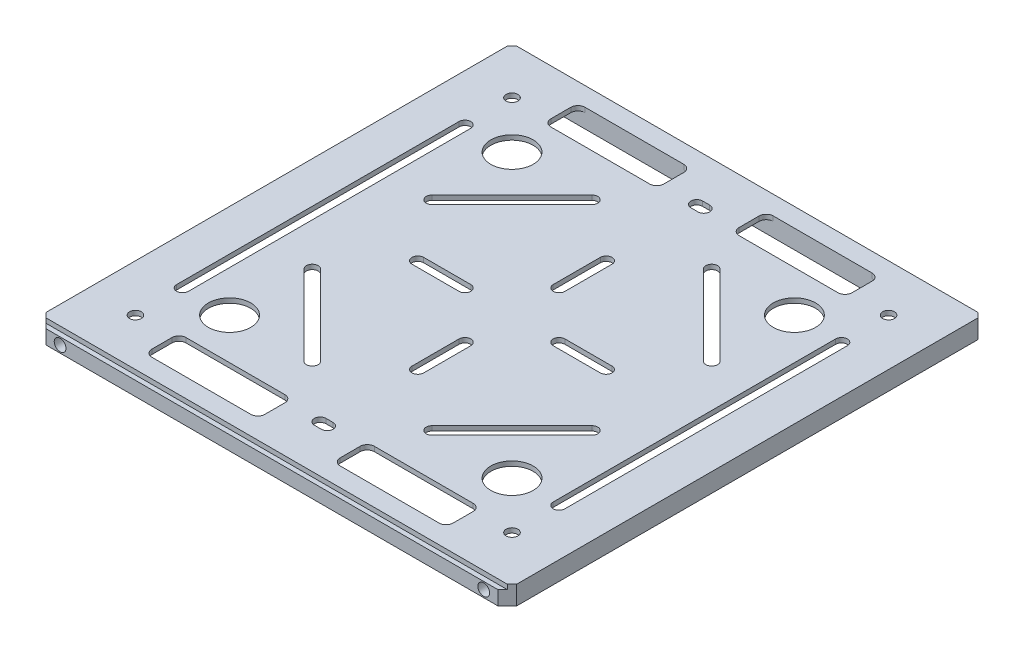
from build123d import *

# Parameters (mm, degrees)
SKETCH2_W                            = 100
SKETCH2_H                            = 100
BOSS_EXTRUDE1_DEPTH                  = 4
CUT_EXTRUDE1_DEPTH                   = 5
SKETCH4_R                            = 1.25
CUT_EXTRUDE2_DEPTH                   = 5
SKETCH5_W                            = 24
SKETCH5_H                            = 7.25
CUT_EXTRUDE3_DEPTH                   = 5
FILLET1_R                            = 1.5
CUT_EXTRUDE4_DEPTH                   = 5
CUT_EXTRUDE6_DEPTH                   = 5
FILLET1_OF_MIRROR1_R                 = 1.5
MIRROR2_DEPTH                        = 4
SKETCH9_W                            = 92
SKETCH9_H                            = 92
CUT_EXTRUDE7_DEPTH                   = 3
FILLET2_R                            = 1.5
CIRPATTERN1_COUNT                    = 4
CUT_EXTRUDE8_DEPTH                   = 10
CIRPATTERN2_COUNT                    = 4
SKETCH11_W                           = 100
SKETCH11_H                           = 3
BOSS_EXTRUDE2_DEPTH                  = 1
CHAMFER1_SIZE                        = 2
CHAMFER2_SIZE                        = 2
CHAMFER3_SIZE                        = 2
CHAMFER4_SIZE                        = 2
TAP_DRILL_FOR_M3X0_5_TAP1_AT_2_COUNT = 2
TAP_DRILL_FOR_M3X0_5_TAP1_AT_2_PITCH = 90
CIRPATTERN4_COUNT                    = 4
F_9_0_9_DIAMETER_HOLE1_D             = 9
CIRPATTERN5_COUNT                    = 4


# Read off the part's stored shape, not the designer's step: Mirror2
with BuildPart() as part:
    # Sketch2 → Boss-Extrude1 (new body)
    with BuildSketch(Plane(origin=(0, 0, 0), x_dir=(1, 0, 0), z_dir=(0, 1, 0))):
        with Locations((50, 50)):
            Rectangle(SKETCH2_W, SKETCH2_H)
    extrude(amount=BOSS_EXTRUDE1_DEPTH)

    # Sketch3 → Cut-Extrude1 (cut)
    with BuildSketch(Plane(origin=(0, 4, 0), x_dir=(1, 0, 0), z_dir=(0, 1, 0))):
        with BuildLine():
            Line((11.25, 80), (11.25, 20))
            ThreePointArc((11.25, 20), (10, 18.75), (8.75, 20))
            Line((8.75, 20), (8.75, 80))
            ThreePointArc((8.75, 80), (10, 81.25), (11.25, 80))
        make_face()
    cut_extrude1 = extrude(amount=-CUT_EXTRUDE1_DEPTH, mode=Mode.SUBTRACT)

    # Sketch4 → Cut-Extrude2 (cut)
    with BuildSketch(Plane(origin=(0, 4, 0), x_dir=(1, 0, 0), z_dir=(0, 1, 0))):
        with Locations(Location((10, 10, 0), (0, 0, 270))):
            Circle(SKETCH4_R)
    cut_extrude2 = extrude(amount=-CUT_EXTRUDE2_DEPTH, mode=Mode.SUBTRACT)

    # Sketch5 → Cut-Extrude3 (cut)
    with BuildSketch(Plane(origin=(0, 4, 0), x_dir=(1, 0, 0), z_dir=(0, 1, 0))):
        with Locations((30, 7.625)):
            Rectangle(SKETCH5_W, SKETCH5_H)
    cut_extrude3 = extrude(amount=-CUT_EXTRUDE3_DEPTH, mode=Mode.SUBTRACT)

    # Fillet1
    fillet1_edges = [part.edges().sort_by_distance(p)[0] for p in [
        (18, 2, -4),
        (18, 2, -11.25),
        (42, 2, -11.25),
        (42, 2, -4),
    ]]
    fillet(fillet1_edges, radius=FILLET1_R)

    # Sketch6 → Cut-Extrude4 (cut)
    with BuildSketch(Plane(origin=(0, 4, 0), x_dir=(1, 0, 0), z_dir=(0, 1, 0))):
        with BuildLine():
            Line((49.25, 11.25), (50.75, 11.25))
            ThreePointArc((50.75, 11.25), (52, 10), (50.75, 8.75))
            Line((50.75, 8.75), (49.25, 8.75))
            ThreePointArc((49.25, 8.75), (48, 10), (49.25, 11.25))
        make_face()
    cut_extrude4 = extrude(amount=-CUT_EXTRUDE4_DEPTH, mode=Mode.SUBTRACT)

    # Sketch8 → Cut-Extrude6 (cut)
    with BuildSketch(Plane(origin=(0, 4, 0), x_dir=(1, 0, 0), z_dir=(0, 1, 0))):
        with BuildLine():
            Line((30, 51.25), (40, 51.25))
            ThreePointArc((40, 51.25), (41.25, 50), (40, 48.75))
            Line((40, 48.75), (30, 48.75))
            ThreePointArc((30, 48.75), (28.75, 50), (30, 51.25))
        make_face()
    cut_extrude6 = extrude(amount=-CUT_EXTRUDE6_DEPTH, mode=Mode.SUBTRACT)

    # Mirror1: Cut-Extrude3 across plane
    add(cut_extrude3.mirror(Plane(origin=(50, 0, 0), x_dir=(0, 0, 1), z_dir=(1, 0, 0))), mode=Mode.SUBTRACT)

    # Fillet1 of Mirror1
    fillet1_of_mirror1_edges = [part.edges().sort_by_distance(p)[0] for p in [
        (82, 2, -4),
        (82, 2, -11.25),
        (58, 2, -11.25),
        (58, 2, -4),
    ]]
    fillet(fillet1_of_mirror1_edges, radius=FILLET1_OF_MIRROR1_R)

    # Mirror2 outline → Mirror2 (cut)
    with BuildSketch(Plane(origin=(0, 0, 0), x_dir=(1, 0, 0), z_dir=(0, 1, 0))):
        with BuildLine():
            Line((18, 94.5), (18, 90.25))
            ThreePointArc((18, 90.25), (18.439339828, 89.189339828), (19.5, 88.75))
            Line((19.5, 88.75), (40.5, 88.75))
            ThreePointArc((40.5, 88.75), (41.560660172, 89.189339828), (42, 90.25))
            Line((42, 90.25), (42, 94.5))
            ThreePointArc((42, 94.5), (41.560660172, 95.560660172), (40.5, 96))
            Line((40.5, 96), (19.5, 96))
            ThreePointArc((19.5, 96), (18.439339828, 95.560660172), (18, 94.5))
        make_face()
        with BuildLine():
            ThreePointArc((80.5, 88.75), (81.560660172, 89.189339828), (82, 90.25))
            Line((82, 90.25), (82, 94.5))
            ThreePointArc((82, 94.5), (81.560660172, 95.560660172), (80.5, 96))
            Line((80.5, 96), (59.5, 96))
            ThreePointArc((59.5, 96), (58.439339828, 95.560660172), (58, 94.5))
            Line((58, 94.5), (58, 90.25))
            ThreePointArc((58, 90.25), (58.439339828, 89.189339828), (59.5, 88.75))
            Line((59.5, 88.75), (80.5, 88.75))
        make_face()
    extrude(amount=MIRROR2_DEPTH, mode=Mode.SUBTRACT)

    # Mirror3: Cut-Extrude1 across plane
    add(cut_extrude1.mirror(Plane(origin=(50, 0, 0), x_dir=(0, 0, 1), z_dir=(1, 0, 0))), mode=Mode.SUBTRACT)

    # Sketch9 → Cut-Extrude7 (cut)
    with BuildSketch(Plane.XZ):
        with Locations((50, -50)):
            Rectangle(SKETCH9_W, SKETCH9_H)
    extrude(amount=-CUT_EXTRUDE7_DEPTH, mode=Mode.SUBTRACT)

    # Fillet2
    fillet2_edges = [part.edges().sort_by_distance(p)[0] for p in [
        (4, 1.5, -4),
        (96, 1.5, -96),
        (4, 1.5, -96),
        (96, 1.5, -4),
    ]]
    fillet(fillet2_edges, radius=FILLET2_R)

    # CirPattern1: Cut-Extrude6 ×4 about axis
    cirpattern1_axis = Axis((50, 0, -50), (0, 1, 0))
    for i in range(1, CIRPATTERN1_COUNT):
        add(cut_extrude6.rotate(cirpattern1_axis, i * 360 / CIRPATTERN1_COUNT), mode=Mode.SUBTRACT)

    # Sketch7 → Cut-Extrude8 (cut)
    with BuildSketch(Plane(origin=(0, 4, 0), x_dir=(1, 0, 0), z_dir=(0, 1, 0))):
        with BuildLine():
            Line((61.847212692, 21.183854166), (78.816087256, 38.153854166))
            ThreePointArc((78.816087256, 38.153854166), (80.583854208, 38.153912786), (80.583912829, 36.386145834))
            Line((80.583912829, 36.386145834), (63.615038264, 19.416145834))
            ThreePointArc((63.615038264, 19.416145834), (61.847271312, 19.416087214), (61.847212692, 21.183854166))
        make_face()
    cut_extrude8 = extrude(amount=-CUT_EXTRUDE8_DEPTH, mode=Mode.SUBTRACT)

    # CirPattern2: Cut-Extrude8 ×4 about axis
    cirpattern2_axis = Axis((50, 0, -50), (0, 1, 0))
    for i in range(1, CIRPATTERN2_COUNT):
        add(cut_extrude8.rotate(cirpattern2_axis, i * 360 / CIRPATTERN2_COUNT), mode=Mode.SUBTRACT)

    # Sketch11 → Boss-Extrude2 (add)
    with BuildSketch(Plane(origin=(0, 0, -100), x_dir=(-1, 0, 0), z_dir=(0, 0, -1))):
        with Locations((-50, 1.5)):
            Rectangle(SKETCH11_W, SKETCH11_H)
    boss_extrude2 = extrude(amount=BOSS_EXTRUDE2_DEPTH)

    # Mirror4: Boss-Extrude2 across plane
    add(boss_extrude2.mirror(Plane(origin=(0, 0, -50), x_dir=(1, 0, 0), z_dir=(0, 0, -1))))

    # Chamfer1
    chamfer1_edges = [part.edges().sort_by_distance(p)[0] for p in [
        (0, 1.5, -101),
    ]]
    chamfer(chamfer1_edges, length=CHAMFER1_SIZE)

    # Chamfer2
    chamfer2_edges = [part.edges().sort_by_distance(p)[0] for p in [
        (0, 1.5, 1),
    ]]
    chamfer(chamfer2_edges, length=CHAMFER2_SIZE)

    # Chamfer3
    chamfer3_edges = [part.edges().sort_by_distance(p)[0] for p in [
        (100, 1.5, 1),
    ]]
    chamfer(chamfer3_edges, length=CHAMFER3_SIZE)

    # Chamfer4
    chamfer4_edges = [part.edges().sort_by_distance(p)[0] for p in [
        (100, 1.5, -101),
    ]]
    chamfer(chamfer4_edges, length=CHAMFER4_SIZE)

    # Sketch13 → Tap Drill for M3x0.5 Tap1 (revolve, cut)
    with BuildSketch(Plane(origin=(5, 1.5, 1), x_dir=(0, -1, 0), z_dir=(1, 0, 0))):
        Polygon((0, 0), (0, 6.751075774), (1.25, 6), (1.25, 0), align=None)
    tap_drill_for_m3x0_5_tap1 = revolve(axis=Axis((5, 1.5, 7.35), (0, 0, -1)), mode=Mode.SUBTRACT)

    # Tap Drill for M3x0.5 Tap1 at 2: Tap Drill for M3x0.5 Tap1 ×2
    with Locations(*[(i * TAP_DRILL_FOR_M3X0_5_TAP1_AT_2_PITCH, 0, 0) for i in range(1, TAP_DRILL_FOR_M3X0_5_TAP1_AT_2_COUNT)]):
        add(tap_drill_for_m3x0_5_tap1, mode=Mode.SUBTRACT)

    # Mirror5: Tap Drill for M3x0.5 Tap1 across plane
    add(tap_drill_for_m3x0_5_tap1.mirror(Plane(origin=(0, 0, -50), x_dir=(1, 0, 0), z_dir=(0, 0, -1))), mode=Mode.SUBTRACT)

    # Mirror5 copy 1 sketch → Mirror5 copy 1 (revolve, cut)
    with BuildSketch(Plane(origin=(95, 1.5, -101), x_dir=(0, -1, 0), z_dir=(1, 0, 0))):
        Polygon((0, 0), (0, -6.751075774), (1.25, -6), (1.25, 0), align=None)
    revolve(axis=Axis((95, 1.5, -107.35), (0, 0, -1)), mode=Mode.SUBTRACT)

    # CirPattern4: Cut-Extrude2 ×4 about axis
    cirpattern4_axis = Axis((50, 0, -50), (0, 1, 0))
    for i in range(1, CIRPATTERN4_COUNT):
        add(cut_extrude2.rotate(cirpattern4_axis, i * 360 / CIRPATTERN4_COUNT), mode=Mode.SUBTRACT)

    # Mirror6: Cut-Extrude4 across plane
    add(cut_extrude4.mirror(Plane(origin=(0, 0, -50), x_dir=(1, 0, 0), z_dir=(0, 0, -1))), mode=Mode.SUBTRACT)

    # Ø9.0 (9) Diameter Hole1 (through all)
    with Locations(Plane(origin=(0, 4, 0), x_dir=(1, 0, 0), z_dir=(0, 1, 0))):
        with Locations((80, 20)):
            f_9_0_9_diameter_hole1 = Hole(F_9_0_9_DIAMETER_HOLE1_D / 2)

    # CirPattern5: Ø9.0 (9) Diameter Hole1 ×4 about axis
    cirpattern5_axis = Axis((50, 0, -50), (0, 1, 0))
    for i in range(1, CIRPATTERN5_COUNT):
        add(f_9_0_9_diameter_hole1.rotate(cirpattern5_axis, i * 360 / CIRPATTERN5_COUNT), mode=Mode.SUBTRACT)


solid = part.part
